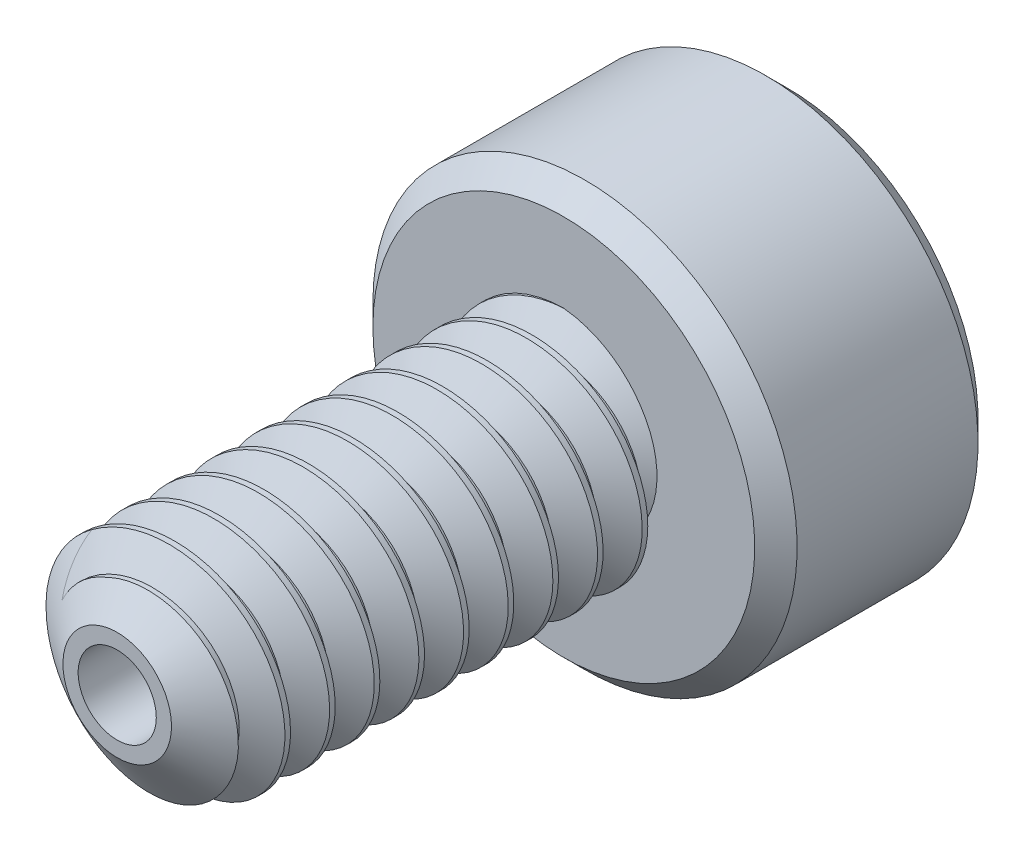
from build123d import *

# Parameters (mm, degrees)
SKETCH1_R          = 1
EXTRUDE1_DEPTH     = 4
CUT_SWEEP1_PITCH   = 0.4
SKETCH6_R          = 1.9
EXTRUDE2_DEPTH     = 2
CUT_EXTRUDE1_DEPTH = 1.125
CHAMFER1_SIZE      = 0.19
SKETCH11_R         = 0.35
CUT_EXTRUDE3_DEPTH = 7.574191966


with BuildPart() as part:
    # Sketch1 → Extrude1 (new body)
    with BuildSketch(Plane.XY):
        Circle(SKETCH1_R)
    extrude(amount=-EXTRUDE1_DEPTH)

    # Cut-Sweep1: the profile of Sketch3 profile screwed along a right-hand helix of 11 turns, 6 arcs to a turn; built about Z, then put on its axis
    cut_sweep1_z = Axis((0, 0, 0), (0, 0, 1))
    cut_sweep1_corners = [(1.0003, 0, -0.350173205), (0.740192379, 0, -0.2), (0.740192379, 0, -0.15), (1.0003, 0, 0.000173205)]
    with BuildLine(mode=Mode.PRIVATE) as cut_sweep1_profile:
        Line(cut_sweep1_corners[0], cut_sweep1_corners[1])
        Line(cut_sweep1_corners[1], cut_sweep1_corners[2])
        Line(cut_sweep1_corners[2], cut_sweep1_corners[3])
        Line(cut_sweep1_corners[3], cut_sweep1_corners[0])
    cut_sweep1_cap = Face(cut_sweep1_profile.wire())
    cut_sweep1_turn_angles = [0, 30, 60, 90, 120, 150, 180, 210, 240, 270, 300, 330, 360]
    cut_sweep1_turn_weights = [1, 0.8660254037844387, 1, 0.8660254037844387, 1, 0.8660254037844387, 1, 0.8660254037844387, 1, 0.8660254037844387, 1, 0.8660254037844387, 1]
    cut_sweep1_turn_rails = [Edge.make_bspline([Vector(p[0], p[1], 0).rotate(cut_sweep1_z, cut_sweep1_turn_angles[k]) / cut_sweep1_turn_weights[k] + Vector(0, 0, p[2] + CUT_SWEEP1_PITCH * cut_sweep1_turn_angles[k] / 360) for k in range(13)], [0, 0, 0, 1, 1, 2, 2, 3, 3, 4, 4, 5, 5, 6, 6, 6], 2, cut_sweep1_turn_weights) for p in cut_sweep1_corners]
    cut_sweep1_turn_sides = [Face.make_surface_from_curves(cut_sweep1_turn_rails[p[0]], cut_sweep1_turn_rails[p[1]]) for p in [(0, 1), (1, 2), (2, 3), (3, 0)]]
    cut_sweep1 = Plane(origin=(0, 0, 0), x_dir=(0, 1, 0), z_dir=(0, 0, -1)) * Solid(Shell([*[p.moved(Location((0, 0, CUT_SWEEP1_PITCH * i))) for i in range(11) for p in cut_sweep1_turn_sides], cut_sweep1_cap, cut_sweep1_cap.rotate(cut_sweep1_z, 3960).moved(Location((0, 0, CUT_SWEEP1_PITCH * 3960 / 360)))]))
    add(cut_sweep1, mode=Mode.SUBTRACT)

    # Sketch4 → Cut-Revolve1 (revolve, cut)
    with BuildSketch(Plane(origin=(0, 0, 0), x_dir=(0, 0, -1), z_dir=(1, 0, 0)), mode=Mode.PRIVATE) as cut_revolve1_sk:
        Polygon((0.35977197, 1), (0, 0.486192379), (0, 1), align=None)
    revolve(cut_revolve1_sk.sketch.rotate(Axis((0, 0, 0), (0, 0, -1)), 278.428757723), axis=Axis((0, 0, 0), (0, 0, -1)), mode=Mode.SUBTRACT)

    # Sketch6 → Extrude2 (add)
    with BuildSketch(Plane(origin=(0, 0, -4), x_dir=(-1, 0, 0), z_dir=(0, 0, -1))):
        Circle(SKETCH6_R)
    extrude(amount=EXTRUDE2_DEPTH)

    # Sketch7 → Cut-Extrude1 (cut)
    with BuildSketch(Plane(origin=(0, 0, -6), x_dir=(-1, 0, 0), z_dir=(0, 0, -1))):
        Polygon((0, 0.866025404), (-0.75, 0.433012702), (-0.75, -0.433012702), (0, -0.866025404), (0.75, -0.433012702), (0.75, 0.433012702), align=None)
    extrude(amount=-CUT_EXTRUDE1_DEPTH, mode=Mode.SUBTRACT)

    # Cut-Extrude2 cone 1 section (through the dimple's axis) → Cut-Extrude2 (revolve, cut)
    with BuildSketch(Plane(origin=(0, 0, -6), x_dir=(0, 1, 0), z_dir=(1, 0, 0))):
        Polygon((0, 0), (0.866025404, 0), (0, 0.866025404), align=None)
    revolve(axis=Axis((0, 0, -6), (0, 0, 1)), mode=Mode.SUBTRACT)

    # Chamfer1
    chamfer1_edges = [part.edges().sort_by_distance(p)[0] for p in [
        (1.9, 0, -4),
        (1.9, 0, -6),
    ]]
    chamfer(chamfer1_edges, length=CHAMFER1_SIZE)

    # Sketch11 → Cut-Extrude3 (cut, through all)
    with BuildSketch(Plane.XY):
        Circle(SKETCH11_R)
    extrude(amount=-CUT_EXTRUDE3_DEPTH, mode=Mode.SUBTRACT)


solid = part.part
